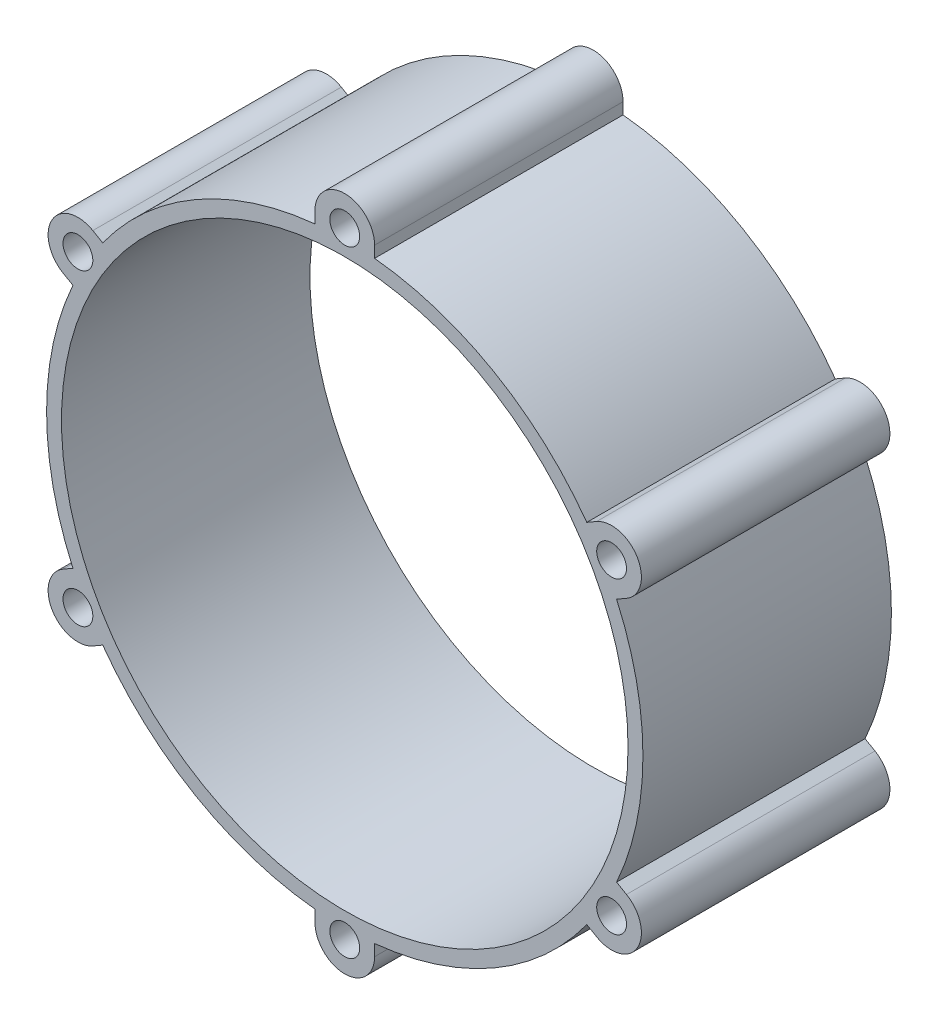
from build123d import *

# Parameters (mm, degrees)
SKETCH1_R           = 57
BOSS_EXTRUDE1_DEPTH = 25
SKETCH3_R           = 3
CUT_EXTRUDE1_DEPTH  = 104.556747728
CIRPATTERN1_COUNT   = 6


with BuildPart() as part:
    # Sketch1 → Boss-Extrude1 (new, symmetric)
    with BuildSketch(Plane.XY):
        with BuildLine():
            Line((6, 59.699246226), (6, 62))
            ThreePointArc((6, 62), (0, 68), (-6, 62))
            Line((-6, 62), (-6, 59.699246226))
            ThreePointArc((-6, 59.699246226), (-30, 51.961524227), (-48.701063819, 35.045775536))
            Line((-48.701063819, 35.045775536), (-50.693575035, 36.196152423))
            ThreePointArc((-50.693575035, 36.196152423), (-58.889727457, 34), (-56.693575035, 25.803847577))
            Line((-56.693575035, 25.803847577), (-54.701063819, 24.65347069))
            ThreePointArc((-54.701063819, 24.65347069), (-60, 0), (-54.701063819, -24.65347069))
            Line((-54.701063819, -24.65347069), (-56.693575035, -25.803847577))
            ThreePointArc((-56.693575035, -25.803847577), (-58.889727457, -34), (-50.693575035, -36.196152423))
            Line((-50.693575035, -36.196152423), (-48.701063819, -35.045775536))
            ThreePointArc((-48.701063819, -35.045775536), (-30, -51.961524227), (-6, -59.699246226))
            Line((-6, -59.699246226), (-6, -62))
            ThreePointArc((-6, -62), (0, -68), (6, -62))
            Line((6, -62), (6, -59.699246226))
            ThreePointArc((6, -59.699246226), (30, -51.961524227), (48.701063819, -35.045775536))
            Line((48.701063819, -35.045775536), (50.693575035, -36.196152423))
            ThreePointArc((50.693575035, -36.196152423), (58.889727457, -34), (56.693575035, -25.803847577))
            Line((56.693575035, -25.803847577), (54.701063819, -24.65347069))
            ThreePointArc((54.701063819, -24.65347069), (60, 0), (54.701063819, 24.65347069))
            Line((54.701063819, 24.65347069), (56.693575035, 25.803847577))
            ThreePointArc((56.693575035, 25.803847577), (58.889727457, 34), (50.693575035, 36.196152423))
            Line((50.693575035, 36.196152423), (48.701063819, 35.045775536))
            ThreePointArc((48.701063819, 35.045775536), (30, 51.961524227), (6, 59.699246226))
        make_face()
        Circle(SKETCH1_R, mode=Mode.SUBTRACT)
    extrude(amount=BOSS_EXTRUDE1_DEPTH, both=True)

    # Sketch3 → Cut-Extrude1 (cut, through all)
    with BuildSketch(Plane(origin=(0, 0, -25), x_dir=(-1, 0, 0), z_dir=(0, 0, -1))):
        with Locations((0, 62)):
            Circle(SKETCH3_R)
    cut_extrude1 = extrude(amount=-CUT_EXTRUDE1_DEPTH, mode=Mode.SUBTRACT)

    # CirPattern1: Cut-Extrude1 ×6 about axis
    cirpattern1_axis = Axis((0, 0, -25), (0, 0, 1))
    for i in range(1, CIRPATTERN1_COUNT):
        add(cut_extrude1.rotate(cirpattern1_axis, i * 360 / CIRPATTERN1_COUNT), mode=Mode.SUBTRACT)


solid = part.part
